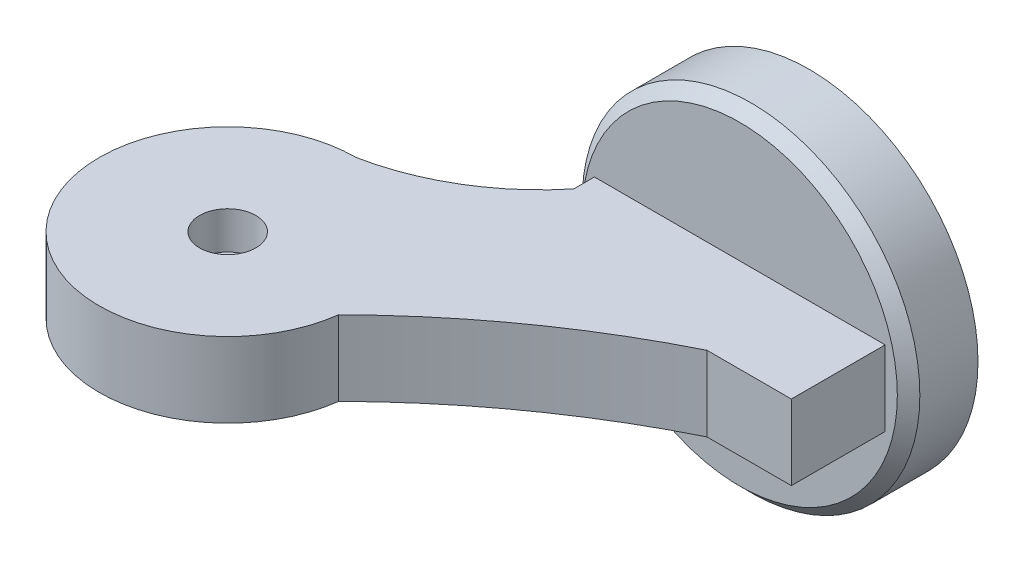
from build123d import *

# Parameters (mm, degrees)
SKETCH1_R                = 90
BOSS_EXTRUDE1_DEPTH      = 37
CHAMFER1_SIZE            = 6
SKETCH2_W                = 155
SKETCH2_H                = 40
BOSS_EXTRUDE2_DEPTH      = 50
CUT_EXTRUDE1_DEPTH       = 167.640331253
BOSS_EXTRUDE5_DEPTH      = 20
BOSS_EXTRUDE7_DEPTH      = 3.75
BOSS_EXTRUDE7_DRAFT      = 70
SKETCH9_R                = 40
BOSS_EXTRUDE10_DEPTH     = 1.5
SKETCH14_R               = 40
BOSS_EXTRUDE12_DEPTH     = 18
BOSS_EXTRUDE12_TAPER     = 28
CUT_EXTRUDE4_REACH       = 345.089
SKETCH18_R               = 1.5
CUT_EXTRUDE5_DEPTH       = 5
CIRPATTERN1_COUNT        = 12
SKETCH19_R               = 22.5
CUT_EXTRUDE6_DEPTH       = 2
CUT_EXTRUDE6_DRAFT       = -45
BOSS_EXTRUDE14_DEPTH     = 4
BOSS_EXTRUDE14_DRAFT     = 20
CIRPATTERN2_COPY_1_DEPTH = 4
CIRPATTERN2_COPY_1_DRAFT = 20
CIRPATTERN2_COPY_2_DEPTH = 4
CIRPATTERN2_COPY_2_DRAFT = 20
CIRPATTERN2_COPY_3_DEPTH = 4
CIRPATTERN2_COPY_3_DRAFT = 20
SKETCH23_R               = 9.955880937
BOSS_EXTRUDE15_DEPTH     = 4
SKETCH24_R               = 5
CUT_EXTRUDE7_DEPTH       = 4
SKETCH25_R               = 15
CUT_EXTRUDE8_DEPTH       = 20
SKETCH26_R               = 15
CUT_EXTRUDE9_DEPTH       = 20


# Read off the part's stored shape, not the designer's step: Boss-Extrude7
with BuildPart() as part:
    # Sketch1 → Boss-Extrude1 (new body)
    with BuildSketch(Plane.XY):
        Circle(SKETCH1_R)
    extrude(amount=BOSS_EXTRUDE1_DEPTH)

    # Chamfer1
    chamfer1_edges = [part.edges().sort_by_distance(p)[0] for p in [
        (-90, 0, 37),
    ]]
    chamfer(chamfer1_edges, length=CHAMFER1_SIZE)

    # Sketch2 → Boss-Extrude2 (add)
    with BuildSketch(Plane.XY.offset(37)):
        Rectangle(SKETCH2_W, SKETCH2_H)
    extrude(amount=BOSS_EXTRUDE2_DEPTH)

    # Sketch3 → Cut-Extrude1 (cut, through all)
    with BuildSketch(Plane.XZ.offset(20)):
        with BuildLine():
            Line((32.5, 87), (-77.5, 87))
            Line((-77.5, 87), (-77.5, 48))
            ThreePointArc((-77.5, 48), (-18.551432041, 56.363013449), (32.5, 87))
        make_face()
    extrude(amount=-CUT_EXTRUDE1_DEPTH, mode=Mode.SUBTRACT)


with BuildPart() as body_2:
    # Sketch4 → Boss-Extrude5 (new, symmetric)
    with BuildSketch(Plane(origin=(0, 0, 0), x_dir=(1, 0, 0), z_dir=(0, 1, 0))):
        with BuildLine():
            ThreePointArc((-150, -91.5), (-201.442894362, -205.23138976), (-82.0632524, -168.766317675))
            ThreePointArc((-82.0632524, -168.766317675), (-28.072291326, -123.272589228), (32.5, -87))
            ThreePointArc((32.5, -87), (-18.551432041, -56.363013449), (-77.5, -48))
            ThreePointArc((-77.5, -48), (-109.960480223, -76.065866296), (-150, -91.5))
        make_face()
    extrude(amount=BOSS_EXTRUDE5_DEPTH, both=True)


with BuildPart() as boss_extrude7_tool:
    # Boss-Extrude7 outline → Boss-Extrude7 (with draft: the straight prism first)
    with BuildSketch(Plane.XZ.offset(23.75)):
        with BuildLine():
            ThreePointArc((-149.050997815, 101.810778399), (-107.143478262, 86.355264818), (-72.55176842, 58.097049986))
            ThreePointArc((-72.55176842, 58.097049986), (-27.103017434, 64.372621937), (13.861539202, 85.03362068))
            ThreePointArc((13.861539202, 85.03362068), (-41.955660049, 120.65385734), (-91.945840434, 164.07439231))
            ThreePointArc((-91.945840434, 164.07439231), (-192.889773588, 199.336413629), (-149.050997815, 101.810778399))
        make_face()
    extrude(amount=-BOSS_EXTRUDE7_DEPTH)
    # Boss-Extrude7: the draft: its side faces are tilted about the plane it starts from
    boss_extrude7_sides = [boss_extrude7_tool.faces().sort_by_distance(p)[0] for p in [
        (-107.143478261, -21.875, 86.355264818),
        (-27.103017434, -21.875, 64.372621937),
        (-41.955660049, -21.875, 120.65385734),
        (-192.889773589, -21.875, 199.336413628),
    ]]
    draft(boss_extrude7_sides, Plane.XZ.offset(23.75), BOSS_EXTRUDE7_DRAFT)


with BuildPart() as part_1:
    add(part.part)

    # Boss-Extrude7: add boss_extrude7_tool
    add(boss_extrude7_tool.part)

    add(body_2.part)  # Boss-Extrude7 merges body 2

    # Sketch9 → Boss-Extrude10 (add, symmetric)
    with BuildSketch(Plane.XZ.offset(23.75)):
        with Locations(Location((-150, 160, 0), (0, 0, 270))):
            Circle(SKETCH9_R)
    extrude(amount=BOSS_EXTRUDE10_DEPTH, both=True)

    # Sketch14 → Boss-Extrude12 (add)
    with BuildSketch(Plane.XZ.offset(25.25)):
        with Locations(Location((-150, 160, 0), (0, 0, 270))):
            Circle(SKETCH14_R)
    extrude(amount=BOSS_EXTRUDE12_DEPTH, taper=BOSS_EXTRUDE12_TAPER)

    # Cut-Extrude4: up to this face of the body (flat: up to its plane)
    cut_extrude4_end = Plane(part_1.part.faces().sort_by_distance((-102.299270891, -23.75, 126.25647004))[0])
    # Sketch17 → Cut-Extrude4 (cut, up to the picked face)
    with BuildSketch(Plane.XZ.offset(43.25), mode=Mode.PRIVATE) as cut_extrude4_sk1:
        with BuildLine():
            ThreePointArc((-144.905787436, 199.674286362), (-150, 200), (-155.094212564, 199.674286362))
            ThreePointArc((-155.094212564, 199.674286362), (-153.604697191, 194.496604719), (-150, 190.492456694))
            ThreePointArc((-150, 190.492456694), (-146.395302809, 194.496604719), (-144.905787436, 199.674286362))
        make_face()
    cut_extrude4_tool1 = split(extrude(cut_extrude4_sk1.sketch, amount=-CUT_EXTRUDE4_REACH, mode=Mode.PRIVATE), bisect_by=cut_extrude4_end, keep=Keep.BOTH, mode=Mode.PRIVATE)
    cut_extrude4 = cut_extrude4_tool1.solids().sort_by(Axis((-150, -43.25, 196.263381), (0, 1, 0)))[0]
    add(cut_extrude4, mode=Mode.SUBTRACT)

    # Sketch18 → Cut-Extrude5 (cut)
    with BuildSketch(Plane.XZ.offset(23.75)):
        with Locations(Location((-150, 195.051758296, 0), (0, 0, 270))):
            Circle(SKETCH18_R)
    cut_extrude5 = extrude(amount=-CUT_EXTRUDE5_DEPTH, mode=Mode.SUBTRACT)

    # CirPattern1: Cut-Extrude4, Cut-Extrude5 ×12 about axis
    cirpattern1_axis = Axis((-150, 0, 160), (0, 1, 0))
    add([cut_extrude4.rotate(cirpattern1_axis, i * 360 / CIRPATTERN1_COUNT) for i in range(1, CIRPATTERN1_COUNT)], mode=Mode.SUBTRACT)
    add([cut_extrude5.rotate(cirpattern1_axis, i * 360 / CIRPATTERN1_COUNT) for i in range(1, CIRPATTERN1_COUNT)], mode=Mode.SUBTRACT)


with BuildPart() as cut_extrude6_tool:
    # Sketch19 → Cut-Extrude6 (with draft: the straight prism first)
    with BuildSketch(Plane.XZ.offset(43.25)):
        with Locations((-150, 160)):
            Circle(SKETCH19_R)
    extrude(amount=-CUT_EXTRUDE6_DEPTH)
    # Cut-Extrude6: the draft: its side faces are tilted about the plane it starts from
    cut_extrude6_sides = [cut_extrude6_tool.faces().sort_by_distance(p)[0] for p in [
        (-172.5, -42.25, 160),
    ]]
    draft(cut_extrude6_sides, Plane.XZ.offset(43.25), CUT_EXTRUDE6_DRAFT)


with BuildPart() as part_2:
    add(part_1.part)

    # Cut-Extrude6: cut by cut_extrude6_tool
    add(cut_extrude6_tool.part, mode=Mode.SUBTRACT)


with BuildPart() as boss_extrude14_tool:
    # Sketch20 → Boss-Extrude14 (with draft: the straight prism first)
    with BuildSketch(Plane.XZ.offset(41.25)):
        with BuildLine():
            ThreePointArc((-154.25, 167.361215932), (-150, 168.5), (-145.75, 167.361215932))
            Line((-145.75, 167.361215932), (-140.25, 176.887495374))
            ThreePointArc((-140.25, 176.887495374), (-150, 179.5), (-159.75, 176.887495374))
            Line((-159.75, 176.887495374), (-154.25, 167.361215932))
        make_face()
    extrude(amount=BOSS_EXTRUDE14_DEPTH)
    # Boss-Extrude14: the draft: its side faces are tilted about the plane it starts from
    boss_extrude14_sides = [boss_extrude14_tool.faces().sort_by_distance(p)[0] for p in [
        (-150, -43.25, 168.5),
        (-143, -43.25, 172.124355653),
        (-150, -43.25, 179.5),
        (-157, -43.25, 172.124355653),
    ]]
    draft(boss_extrude14_sides, Plane.XZ.offset(41.25), BOSS_EXTRUDE14_DRAFT)


with BuildPart() as part_3:
    add(part_2.part)

    # Boss-Extrude14: add boss_extrude14_tool
    add(boss_extrude14_tool.part)


with BuildPart() as cirpattern2_copy_1_tool:
    # CirPattern2 copy 1 sketch → CirPattern2 copy 1 (with draft: the straight prism first)
    with BuildSketch(Plane(origin=(-310, -41.25, 10), x_dir=(0, 0, -1), z_dir=(0, -1, 0))):
        with BuildLine():
            ThreePointArc((-154.25, 167.361215932), (-150, 168.5), (-145.75, 167.361215932))
            Line((-145.75, 167.361215932), (-140.25, 176.887495374))
            ThreePointArc((-140.25, 176.887495374), (-150, 179.5), (-159.75, 176.887495374))
            Line((-159.75, 176.887495374), (-154.25, 167.361215932))
        make_face()
    extrude(amount=CIRPATTERN2_COPY_1_DEPTH)
    # CirPattern2 copy 1: the draft: its side faces are tilted about the plane it starts from
    cirpattern2_copy_1_sides = [cirpattern2_copy_1_tool.faces().sort_by_distance(p)[0] for p in [
        (-141.5, -43.25, 160),
        (-137.875644347, -43.25, 153),
        (-130.5, -43.25, 160),
        (-137.875644347, -43.25, 167),
    ]]
    draft(cirpattern2_copy_1_sides, Plane(origin=(-310, -41.25, 10), x_dir=(0, 0, -1), z_dir=(0, -1, 0)), CIRPATTERN2_COPY_1_DRAFT)


with BuildPart() as part_4:
    add(part_3.part)

    # CirPattern2 copy 1: add cirpattern2_copy_1_tool
    add(cirpattern2_copy_1_tool.part)


with BuildPart() as cirpattern2_copy_2_tool:
    # CirPattern2 copy 2 sketch → CirPattern2 copy 2 (with draft: the straight prism first)
    with BuildSketch(Plane(origin=(-300, -41.25, 320), x_dir=(-1, 0, 0), z_dir=(0, -1, 0))):
        with BuildLine():
            ThreePointArc((-154.25, 167.361215932), (-150, 168.5), (-145.75, 167.361215932))
            Line((-145.75, 167.361215932), (-140.25, 176.887495374))
            ThreePointArc((-140.25, 176.887495374), (-150, 179.5), (-159.75, 176.887495374))
            Line((-159.75, 176.887495374), (-154.25, 167.361215932))
        make_face()
    extrude(amount=CIRPATTERN2_COPY_2_DEPTH)
    # CirPattern2 copy 2: the draft: its side faces are tilted about the plane it starts from
    cirpattern2_copy_2_sides = [cirpattern2_copy_2_tool.faces().sort_by_distance(p)[0] for p in [
        (-150, -43.25, 151.5),
        (-157, -43.25, 147.875644347),
        (-150, -43.25, 140.5),
        (-143, -43.25, 147.875644347),
    ]]
    draft(cirpattern2_copy_2_sides, Plane(origin=(-300, -41.25, 320), x_dir=(-1, 0, 0), z_dir=(0, -1, 0)), CIRPATTERN2_COPY_2_DRAFT)


with BuildPart() as part_5:
    add(part_4.part)

    # CirPattern2 copy 2: add cirpattern2_copy_2_tool
    add(cirpattern2_copy_2_tool.part)


with BuildPart() as cirpattern2_copy_3_tool:
    # CirPattern2 copy 3 sketch → CirPattern2 copy 3 (with draft: the straight prism first)
    with BuildSketch(Plane(origin=(10, -41.25, 310), x_dir=(0, 0, 1), z_dir=(0, -1, 0))):
        with BuildLine():
            ThreePointArc((-154.25, 167.361215932), (-150, 168.5), (-145.75, 167.361215932))
            Line((-145.75, 167.361215932), (-140.25, 176.887495374))
            ThreePointArc((-140.25, 176.887495374), (-150, 179.5), (-159.75, 176.887495374))
            Line((-159.75, 176.887495374), (-154.25, 167.361215932))
        make_face()
    extrude(amount=CIRPATTERN2_COPY_3_DEPTH)
    # CirPattern2 copy 3: the draft: its side faces are tilted about the plane it starts from
    cirpattern2_copy_3_sides = [cirpattern2_copy_3_tool.faces().sort_by_distance(p)[0] for p in [
        (-158.5, -43.25, 160),
        (-162.124355653, -43.25, 167),
        (-169.5, -43.25, 160),
        (-162.124355653, -43.25, 153),
    ]]
    draft(cirpattern2_copy_3_sides, Plane(origin=(10, -41.25, 310), x_dir=(0, 0, 1), z_dir=(0, -1, 0)), CIRPATTERN2_COPY_3_DRAFT)


with BuildPart() as part_6:
    add(part_5.part)

    # CirPattern2 copy 3: add cirpattern2_copy_3_tool
    add(cirpattern2_copy_3_tool.part)

    # Sketch23 → Boss-Extrude15 (add)
    with BuildSketch(Plane.XZ.offset(41.25)):
        with Locations((-150, 160)):
            Circle(SKETCH23_R)
    extrude(amount=BOSS_EXTRUDE15_DEPTH)

    # Sketch24 → Cut-Extrude7 (cut)
    with BuildSketch(Plane.XZ.offset(45.25)):
        with Locations(Location((-150, 160, 0), (0, 0, 270))):
            Circle(SKETCH24_R)
    extrude(amount=-CUT_EXTRUDE7_DEPTH, mode=Mode.SUBTRACT)

    # Sketch25 → Cut-Extrude8 (cut)
    with BuildSketch(Plane(origin=(0, 20, 0), x_dir=(1, 0, 0), z_dir=(0, 1, 0))):
        with Locations(Location((-150, -160, 0), (0, 0, 270))):
            Circle(SKETCH25_R)
    extrude(amount=-CUT_EXTRUDE8_DEPTH, mode=Mode.SUBTRACT)

    # Sketch26 → Cut-Extrude9 (cut)
    with BuildSketch(Plane(origin=(0, 0, 0), x_dir=(-1, 0, 0), z_dir=(0, 0, -1))):
        Circle(SKETCH26_R)
    extrude(amount=-CUT_EXTRUDE9_DEPTH, mode=Mode.SUBTRACT)


solid = part_6.part
